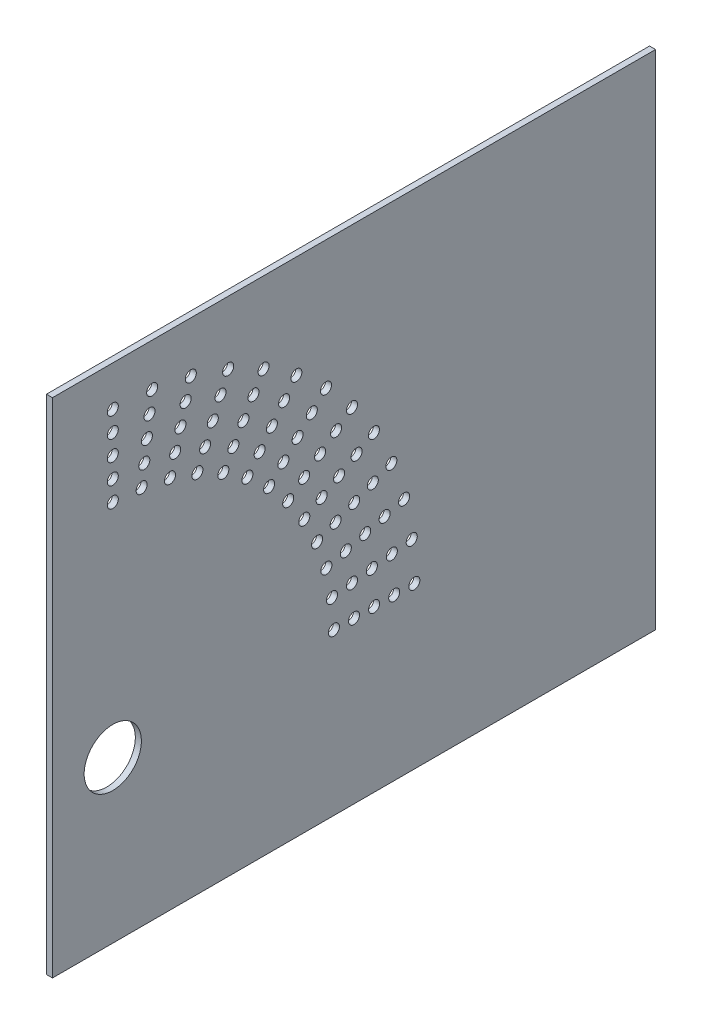
from build123d import *

# Parameters (mm, degrees)
SKETCH1_W           = 300
SKETCH1_H           = 250
SKETCH1_R           = 14.235
BOSS_EXTRUDE1_DEPTH = 3
SKETCH3_R           = 2.75
CUT_EXTRUDE2_DEPTH  = 3
CIRPATTERN1_COUNT   = 13
CIRPATTERN1_ANGLE   = 90


with BuildPart() as part:
    # Sketch1 → Boss-Extrude1 (new body)
    with BuildSketch(Plane(origin=(0, 0, 0), x_dir=(0, 0, -1), z_dir=(1, 0, 0))):
        with Locations((150, 125)):
            Rectangle(SKETCH1_W, SKETCH1_H)
        with Locations((30, 80)):
            Circle(SKETCH1_R, mode=Mode.SUBTRACT)
    extrude(amount=BOSS_EXTRUDE1_DEPTH)

    # Sketch3 → Cut-Extrude2 (cut)
    with BuildSketch(Plane(origin=(3, 0, 0), x_dir=(0, 0, -1), z_dir=(1, 0, 0))):
        with Locations((30, 230)):
            Circle(SKETCH3_R)
        with Locations((30, 220)):
            Circle(SKETCH3_R)
        with Locations((30, 210)):
            Circle(SKETCH3_R)
        with Locations((30, 200)):
            Circle(SKETCH3_R)
        with Locations((30, 190)):
            Circle(SKETCH3_R)
    cut_extrude2 = extrude(amount=-CUT_EXTRUDE2_DEPTH, mode=Mode.SUBTRACT)

    # CirPattern1: Cut-Extrude2 ×13 about axis
    cirpattern1_axis = Axis((3, 80, -30), (-1, 0, 0))
    for i in range(1, CIRPATTERN1_COUNT):
        add(cut_extrude2.rotate(cirpattern1_axis, i * CIRPATTERN1_ANGLE / (CIRPATTERN1_COUNT - 1)), mode=Mode.SUBTRACT)


solid = part.part
